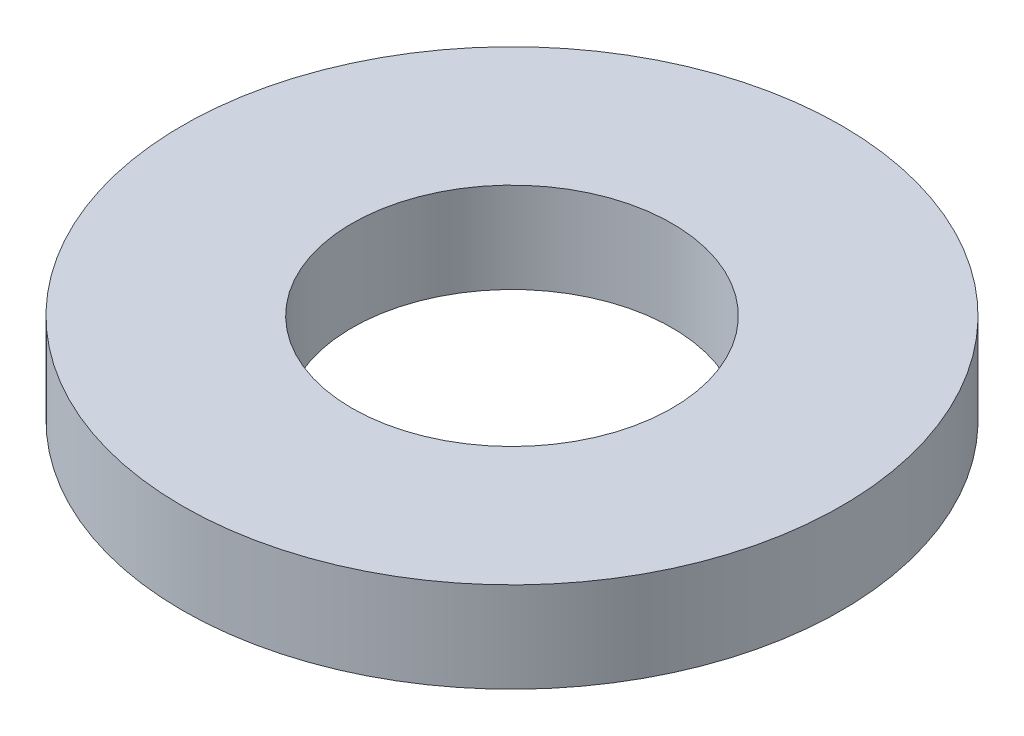
from build123d import *

# Parameters (mm, degrees)
SKETCH1_R           = 87.5
BOSS_EXTRUDE1_DEPTH = 24
SKETCH2_R           = 42.5
CUT_EXTRUDE1_DEPTH  = 127.049593415


with BuildPart() as part:
    # Sketch1 → Boss-Extrude1 (new body)
    with BuildSketch(Plane(origin=(0, 0, 0), x_dir=(1, 0, 0), z_dir=(0, 1, 0))):
        Circle(SKETCH1_R)
    extrude(amount=BOSS_EXTRUDE1_DEPTH)

    # Sketch2 → Cut-Extrude1 (cut, through all)
    with BuildSketch(Plane(origin=(0, 0, 0), x_dir=(1, 0, 0), z_dir=(0, 1, 0))):
        Circle(SKETCH2_R)
    extrude(amount=CUT_EXTRUDE1_DEPTH, mode=Mode.SUBTRACT)


solid = part.part
